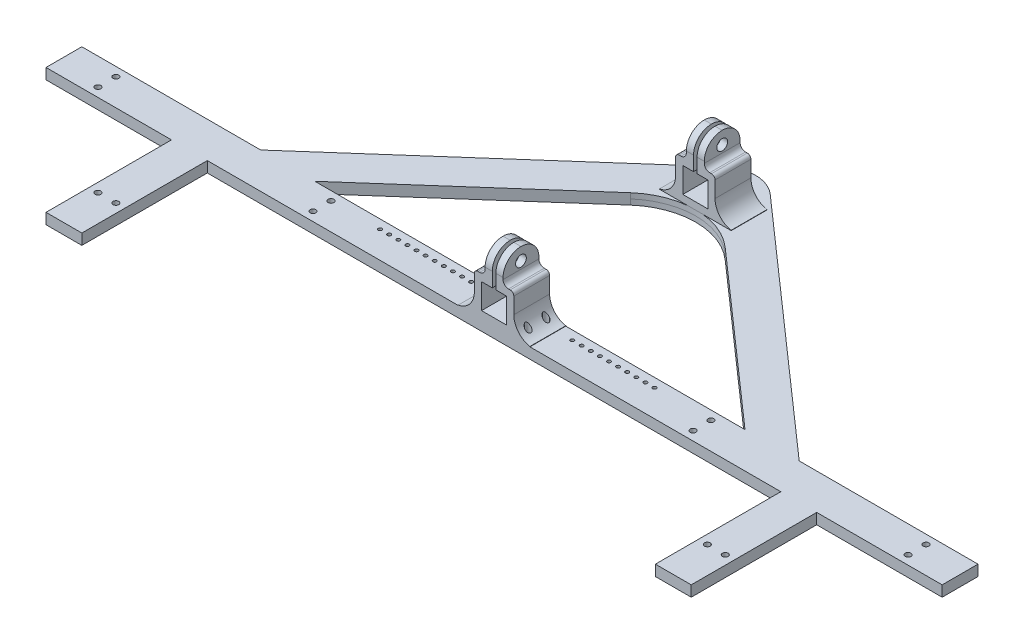
from build123d import *

# Parameters (mm, degrees)
EXTRUDE_1_DEPTH      = 1.5
EXTRUDE_10_DEPTH     = 1.5
FILLET_1_R           = 10
FILLET_2_R           = 20
EXTRUDE_11_DEPTH     = 20
SKETCH_26_W          = 22
SKETCH_26_H          = 10
EXTRUDE_12_DEPTH     = 20
EXTRUDE_13_DEPTH     = 35
EXTRUDE_14_DEPTH     = 35
EXTRUDE_15_DEPTH     = 1.5
FILLET_5_R           = 20
FILLET_6_R           = 10
SKETCH_58_R          = 0.8000000000000042
SKETCH_58_R_2        = 0.8000000000000055
SKETCH_58_R_3        = 0.8000000000000044
SKETCH_58_R_4        = 0.7999999999999963
SKETCH_58_R_5        = 0.8000000000000119
SKETCH_58_R_6        = 0.7999999999999946
SKETCH_58_R_7        = 0.7999999999999954
SKETCH_58_R_8        = 0.7999999999999948
SKETCH_58_R_9        = 0.8000000000000026
CUT_EXTRUDE_52_DEPTH = 145.10569310974057
CUT_EXTRUDE_START    = -66.141850112
CUT_EXTRUDE_53_DEPTH = 66.141850112
FILLET_7_R           = 5
SKETCH_59_R          = 1.5000000000000004
CUT_EXTRUDE_54_DEPTH = 146.77019855456987
SKETCH_60_R          = 1.5000000000000042
CUT_EXTRUDE_55_DEPTH = 146.77019855456987
FILLET_8_R           = 1.5
FILLET_9_R           = 1
CUT_EXTRUDE_56_DEPTH = 144.39264551098404


# Read off the part's stored shape, not the designer's step: 切除-拉伸53
with BuildPart() as part:
    # 草图1 → 凸台-拉伸1 (new body)
    with BuildSketch(Plane(origin=(0, 0, 0), x_dir=(1, 0, 0), z_dir=(0, 1, 0))):
        Polygon((-125, 4.999999999999984), (124.99999999999996, 4.999999999999984), (124.99999999999996, -5.0000000000000115), (-125.00000000000003, -5.0000000000000115), align=None)
    extrude(amount=EXTRUDE_1_DEPTH)



with BuildPart() as body_2:
    # 草图22 → 凸台-拉伸10 (new body)
    with BuildSketch(Plane.XZ):
        Polygon((-3.09e-14, -71.24835955462486), (-3.362e-14, -57.91502622129154), (-60.00000000000021, -4.9999999999999805), (-75.11857892036937, -4.9999999999999805), align=None)
        Polygon((60.00000000000021, -4.9999999999999645), (1.388e-14, -57.91502622129154), (-3.09e-14, -71.24835955462486), (75.1185789203694, -4.999999999999957), align=None)
    extrude(amount=-EXTRUDE_10_DEPTH)

    # 圆角1
    fillet_1_edges = [body_2.edges().sort_by_distance(p)[0] for p in [
        (-8.35e-15, 0.75, -71.24835955462484),
    ]]
    fillet(fillet_1_edges, radius=FILLET_1_R)

    # 圆角2
    fillet_2_edges = [body_2.edges().sort_by_distance(p)[0] for p in [
        (-9.71e-15, 0.75, -57.91502622129154),
    ]]
    fillet(fillet_2_edges, radius=FILLET_2_R)


with BuildPart() as part_1:
    add(part.part)

    add(body_2.part)  # 凸台-拉伸11 merges body 2
    # 草图24 → 凸台-拉伸11 (add)
    with BuildSketch(Plane(origin=(0, 1.5, 0), x_dir=(1, 0, 0), z_dir=(0, 1, 0))):
        Polygon((-10.000000000000004, 4.999999999999999), (9.999999999999996, 4.999999999999999), (9.999999999999996, -5.000000000000001), (-10.000000000000002, -5.000000000000001), align=None)
    extrude(amount=EXTRUDE_11_DEPTH)

    # 草图26 → 凸台-拉伸12 (add)
    with BuildSketch(Plane(origin=(0, 1.5, 0), x_dir=(1, 0, 0), z_dir=(0, 1, 0))):
        with Locations((-1.78e-15, 56.141850111775966)):
            Rectangle(SKETCH_26_W, SKETCH_26_H)
    extrude(amount=EXTRUDE_12_DEPTH)

    # 草图41 → 凸台-拉伸13 (add)
    with BuildSketch(Plane.XY.offset(5.0000000000000115)):
        Polygon((89.99999999999996, 1.4999999999999951), (79.99999999999996, 1.4999999999999951), (79.99999999999996, -4.88e-15), (89.99999999999996, -4.99e-15), (89.99999999999996, 0.7499999999999958), align=None)
    extrude(amount=EXTRUDE_13_DEPTH)

    # 草图42 → 凸台-拉伸14 (add)
    with BuildSketch(Plane.XY.offset(5.0000000000000115)):
        Polygon((-80, 1.4999999999999998), (-90, 1.4999999999999998), (-90, 0.75), (-90, -2.2e-16), (-80, -2.2e-16), align=None)
    extrude(amount=EXTRUDE_14_DEPTH)

    # 草图57 → 凸台-拉伸15 (add)
    with BuildSketch(Plane(origin=(0, 0, 0), x_dir=(-1, 0, 0), z_dir=(0, -1, 0))):
        Polygon((125.00000000000003, -5.0000000000000115), (90, -5.0000000000000115), (90, -40.000000000000014), (80, -40.000000000000014), (80, -5.0000000000000115), (-79.99999999999996, -5.0000000000000115), (-79.99999999999996, -40.000000000000014), (-89.99999999999996, -40.000000000000014), (-89.99999999999994, -5.0000000000000115), (-124.99999999999996, -5.0000000000000115), (-124.99999999999996, 4.999999999999984), (-75.11857892036936, 4.999999999999984), (-6.614378277661482, 65.41502622129155), (-3.024e-14, 71.24835955462483), (6.614378277661415, 65.41502622129157), (75.11857892036936, 4.999999999999984), (125, 4.999999999999984), align=None)
        Polygon((60.00000000000022, 4.999999999999984), (-60.00000000000011, 4.999999999999984), (-2.082e-14, 57.915026221291534), align=None, mode=Mode.SUBTRACT)
    extrude(amount=EXTRUDE_15_DEPTH)

    # 圆角5
    fillet_5_edges = [part_1.edges().sort_by_distance(p)[0] for p in [
        (2.082e-14, -0.75, -57.915026221291534),
    ]]
    fillet(fillet_5_edges, radius=FILLET_5_R)

    # 圆角6
    fillet_6_edges = [part_1.edges().sort_by_distance(p)[0] for p in [
        (3.024e-14, -0.75, -71.24835955462483),
    ]]
    fillet(fillet_6_edges, radius=FILLET_6_R)

    # 草图58 → 切除-拉伸52 (cut, through all)
    with BuildSketch(Plane.XZ.offset(1.5)):
        with Locations(Location((7, 2.499999999999986, 0), (0, 0, 270))):
            Circle(SKETCH_58_R)
        with Locations(Location((6.999999999999998, -2.5000000000000147, 0), (0, 0, 270))):
            Circle(SKETCH_58_R_2)
        with Locations(Location((53, 2.5000000000000027, 0), (0, 0, 270))):
            Circle(SKETCH_58_R_3)
        with Locations(Location((53.000000000000014, -2.5000000000000027, 0), (0, 0, 270))):
            Circle(SKETCH_58_R_4)
        with Locations(Location((112.99999999999994, 2.5000000000000138, 0), (0, 0, 270))):
            Circle(SKETCH_58_R_5)
        with Locations(Location((112.99999999999997, -2.500000000000007, 0), (0, 0, 270))):
            Circle(SKETCH_58_R_6)
        with Locations(Location((-87.5, 28.000000000000014, 0), (0, 0, 270))):
            Circle(SKETCH_58_R_7)
        with Locations(Location((-82.49999999999999, 28.000000000000007, 0), (0, 0, 270))):
            Circle(SKETCH_58_R_8)
        with Locations(Location((-112.99999999999996, -2.5, 0), (0, 0, 270))):
            Circle(SKETCH_58_R_7)
        with Locations(Location((-112.99999999999996, 2.4999999999999987, 0), (0, 0, 270))):
            Circle(SKETCH_58_R_7)
        with Locations(Location((-53, -2.5, 0), (0, 0, 270))):
            Circle(SKETCH_58_R_9)
        with Locations(Location((-53, 2.5, 0), (0, 0, 270))):
            Circle(SKETCH_58_R_9)
        with Locations(Location((82.49999999999999, 28.000000000000036, 0), (0, 0, 270))):
            Circle(SKETCH_58_R_7)
        with Locations(Location((87.5, 28.000000000000036, 0), (0, 0, 270))):
            Circle(SKETCH_58_R_7)
    extrude(amount=-CUT_EXTRUDE_52_DEPTH, mode=Mode.SUBTRACT)

    # 切除-拉伸53 outline → 切除-拉伸53 (cut)
    with BuildSketch(Plane.XY.offset(5.0000000000000115).offset(CUT_EXTRUDE_START)):
        with BuildLine():
            Line((11, 21.5), (-11, 21.5))
            Line((-11, 21.5), (-11, 1.5))
            Line((-11, 1.5), (-10, 1.5))
            Line((-10, 1.5), (-10, 1.591673087))
            ThreePointArc((-10, 1.591673087), (-6.772116369, 3.48218818), (-5.5, 7))
            Line((-5.5, 7), (-5.5, 12.5))
            Line((-5.5, 12.5), (-2.5, 12.5))
            Line((-2.5, 12.5), (-2.5, 19.5))
            Line((-2.5, 19.5), (-0.5, 19.5))
            Line((-0.5, 19.5), (-0.5, 10.5))
            Line((-0.5, 10.5), (-3.5, 10.5))
            Line((-3.5, 10.5), (-3.5, 3.5))
            Line((-3.5, 3.5), (3.5, 3.5))
            Line((3.5, 3.5), (3.5, 10.5))
            Line((3.5, 10.5), (0.5, 10.5))
            Line((0.5, 10.5), (0.5, 19.5))
            Line((0.5, 19.5), (2.5, 19.5))
            Line((2.5, 19.5), (2.5, 12.5))
            Line((2.5, 12.5), (5.5, 12.5))
            Line((5.5, 12.5), (5.5, 7))
            ThreePointArc((5.5, 7), (6.772116369, 3.48218818), (10, 1.591673087))
            Line((10, 1.591673087), (10, 1.5))
            Line((10, 1.5), (11, 1.5))
            Line((11, 1.5), (11, 21.5))
        make_face()
    extrude(amount=CUT_EXTRUDE_53_DEPTH, mode=Mode.SUBTRACT)

    # 圆角7
    fillet_7_edges = [part_1.edges().sort_by_distance(p)[0] for p in [
        (-1.5, 19.5, -51.141850111775966),
        (-1.5, 19.5, -61.141850111999986),
        (1.5, 19.5, -61.141850111999986),
        (1.5, 19.5, -51.141850111775966),
        (-1.5, 19.5, 5.0000000000000115),
        (-1.5, 19.5, -4.999999999999985),
        (1.5, 19.5, -4.999999999999985),
        (1.5, 19.5, 5.0000000000000115),
    ]]
    fillet(fillet_7_edges, radius=FILLET_7_R - 0.0001)  # a hair under: the kernel refuses the full size

    # 草图59 → 切除-拉伸54 (cut, through all)
    with BuildSketch(Plane(origin=(2.5000000000000044, 4.6e-16, 0), x_dir=(0, 0, -1), z_dir=(1, 1.9e-16, 0))):
        with Locations(Location((4.3e-16, 16, 0), (0, 0, 180))):
            Circle(SKETCH_59_R)
    extrude(amount=-CUT_EXTRUDE_54_DEPTH, mode=Mode.SUBTRACT)

    # 草图60 → 切除-拉伸55 (cut, through all)
    with BuildSketch(Plane(origin=(2.5000000000000044, 4.6e-16, 0), x_dir=(0, 0, -1), z_dir=(1, 1.9e-16, 0))):
        with Locations(Location((56.14185011177597, 16, 0), (0, 0, 90))):
            Circle(SKETCH_60_R)
    extrude(amount=-CUT_EXTRUDE_55_DEPTH, mode=Mode.SUBTRACT)

    # 圆角8
    fillet_8_edges = [part_1.edges().sort_by_distance(p)[0] for p in [
        (-2.5, 12.5, 1.421e-14),
        (-2.5, 12.5, -56.141850111887976),
        (2.5, 12.5, 1.421e-14),
        (2.5, 12.5, -56.141850111887976),
    ]]
    fillet(fillet_8_edges, radius=FILLET_8_R)

    # 圆角9
    fillet_9_edges = [part_1.edges().sort_by_distance(p)[0] for p in [
        (5.5, 12.5, 1.421e-14),
        (5.5, 12.5, -56.141850111887976),
        (-5.5, 12.5, 1.421e-14),
        (-5.5, 12.5, -56.141850111887976),
    ]]
    fillet(fillet_9_edges, radius=FILLET_9_R)

    # 草图61 → 切除-拉伸56 (cut, through all)
    with BuildSketch(Plane(origin=(0, 1.5, 0), x_dir=(1, 0, 0), z_dir=(0, 1, 0))):
        with BuildLine():
            ThreePointArc((-38.8, 2.5000000000000075), (-39.3, 3.0000000000000067), (-39.8, 2.5000000000000075))
            Line((-39.8, 2.5000000000000075), (-38.8, 2.5000000000000075))
        make_face()
        with BuildLine():
            Line((-38.8, 2.5000000000000075), (-39.8, 2.5000000000000075))
            ThreePointArc((-39.8, 2.5000000000000075), (-39.3, 2.0000000000000084), (-38.8, 2.5000000000000075))
        make_face()
        with BuildLine():
            ThreePointArc((-36.25999999999999, 2.5000000000000075), (-36.75999999999999, 3.0000000000000067), (-37.25999999999999, 2.5000000000000075))
            Line((-37.25999999999999, 2.5000000000000075), (-36.25999999999999, 2.5000000000000075))
        make_face()
        with BuildLine():
            Line((-36.25999999999999, 2.5000000000000075), (-37.25999999999999, 2.5000000000000075))
            ThreePointArc((-37.25999999999999, 2.5000000000000075), (-36.75999999999999, 2.0000000000000084), (-36.25999999999999, 2.5000000000000075))
        make_face()
        with BuildLine():
            ThreePointArc((-33.71999999999999, 2.5000000000000075), (-34.21999999999999, 3.0000000000000067), (-34.71999999999999, 2.5000000000000075))
            Line((-34.71999999999999, 2.5000000000000075), (-33.71999999999999, 2.5000000000000075))
        make_face()
        with BuildLine():
            Line((-33.71999999999999, 2.5000000000000075), (-34.71999999999999, 2.5000000000000075))
            ThreePointArc((-34.71999999999999, 2.5000000000000075), (-34.21999999999999, 2.0000000000000084), (-33.71999999999999, 2.5000000000000075))
        make_face()
        with BuildLine():
            ThreePointArc((-31.179999999999993, 2.5000000000000075), (-31.679999999999993, 3.0000000000000067), (-32.17999999999999, 2.5000000000000075))
            Line((-32.17999999999999, 2.5000000000000075), (-31.179999999999993, 2.5000000000000075))
        make_face()
        with BuildLine():
            Line((-31.179999999999993, 2.5000000000000075), (-32.17999999999999, 2.5000000000000075))
            ThreePointArc((-32.17999999999999, 2.5000000000000075), (-31.679999999999993, 2.0000000000000084), (-31.179999999999993, 2.5000000000000075))
        make_face()
        with BuildLine():
            ThreePointArc((-28.639999999999993, 2.5000000000000075), (-29.139999999999993, 3.0000000000000067), (-29.639999999999993, 2.5000000000000075))
            Line((-29.639999999999993, 2.5000000000000075), (-28.639999999999993, 2.5000000000000075))
        make_face()
        with BuildLine():
            Line((-28.639999999999993, 2.5000000000000075), (-29.639999999999993, 2.5000000000000075))
            ThreePointArc((-29.639999999999993, 2.5000000000000075), (-29.139999999999993, 2.0000000000000084), (-28.639999999999993, 2.5000000000000075))
        make_face()
        with BuildLine():
            ThreePointArc((-26.09999999999999, 2.5000000000000075), (-26.59999999999999, 3.0000000000000067), (-27.09999999999999, 2.5000000000000075))
            Line((-27.09999999999999, 2.5000000000000075), (-26.09999999999999, 2.5000000000000075))
        make_face()
        with BuildLine():
            Line((-26.09999999999999, 2.5000000000000075), (-27.09999999999999, 2.5000000000000075))
            ThreePointArc((-27.09999999999999, 2.5000000000000075), (-26.59999999999999, 2.0000000000000084), (-26.09999999999999, 2.5000000000000075))
        make_face()
        with BuildLine():
            ThreePointArc((-23.55999999999999, 2.500000000000008), (-24.05999999999999, 3.000000000000007), (-24.55999999999999, 2.500000000000008))
            Line((-24.55999999999999, 2.5000000000000075), (-23.55999999999999, 2.5000000000000075))
        make_face()
        with BuildLine():
            Line((-23.55999999999999, 2.5000000000000075), (-24.55999999999999, 2.5000000000000075))
            ThreePointArc((-24.55999999999999, 2.500000000000008), (-24.05999999999999, 2.000000000000009), (-23.55999999999999, 2.500000000000008))
        make_face()
        with BuildLine():
            ThreePointArc((-21.01999999999999, 2.5000000000000075), (-21.51999999999999, 3.0000000000000067), (-22.01999999999999, 2.5000000000000075))
            Line((-22.01999999999999, 2.5000000000000075), (-21.01999999999999, 2.5000000000000075))
        make_face()
        with BuildLine():
            Line((-21.01999999999999, 2.5000000000000075), (-22.01999999999999, 2.5000000000000075))
            ThreePointArc((-22.01999999999999, 2.5000000000000075), (-21.51999999999999, 2.0000000000000084), (-21.01999999999999, 2.5000000000000075))
        make_face()
        with BuildLine():
            ThreePointArc((-18.47999999999999, 2.5000000000000075), (-18.97999999999999, 3.0000000000000067), (-19.47999999999999, 2.5000000000000075))
            Line((-19.47999999999999, 2.5000000000000075), (-18.47999999999999, 2.5000000000000075))
        make_face()
        with BuildLine():
            Line((-18.47999999999999, 2.5000000000000075), (-19.47999999999999, 2.5000000000000075))
            ThreePointArc((-19.47999999999999, 2.5000000000000075), (-18.97999999999999, 2.0000000000000084), (-18.47999999999999, 2.5000000000000075))
        make_face()
        with BuildLine():
            ThreePointArc((-15.939999999999992, 2.500000000000007), (-16.43999999999999, 3.000000000000006), (-16.93999999999999, 2.500000000000007))
            Line((-16.93999999999999, 2.5000000000000075), (-15.93999999999999, 2.5000000000000075))
        make_face()
        with BuildLine():
            Line((-15.93999999999999, 2.5000000000000075), (-16.93999999999999, 2.5000000000000075))
            ThreePointArc((-16.93999999999999, 2.500000000000007), (-16.43999999999999, 2.000000000000008), (-15.939999999999992, 2.500000000000007))
        make_face()
        with BuildLine():
            ThreePointArc((-13.399999999999988, 2.500000000000008), (-13.899999999999988, 3.000000000000009), (-14.399999999999988, 2.500000000000008))
            Line((-14.399999999999984, 2.5000000000000075), (-13.399999999999984, 2.5000000000000075))
        make_face()
        with BuildLine():
            Line((-13.399999999999984, 2.5000000000000075), (-14.399999999999984, 2.5000000000000075))
            ThreePointArc((-14.399999999999988, 2.500000000000008), (-13.899999999999988, 2.000000000000007), (-13.399999999999988, 2.500000000000008))
        make_face()
        with BuildLine():
            ThreePointArc((-10.859999999999989, 2.5000000000000075), (-11.359999999999989, 3.000000000000008), (-11.859999999999989, 2.5000000000000075))
            Line((-11.859999999999992, 2.5000000000000075), (-10.859999999999992, 2.5000000000000075))
        make_face()
        with BuildLine():
            Line((-10.859999999999992, 2.5000000000000075), (-11.859999999999992, 2.5000000000000075))
            ThreePointArc((-11.859999999999989, 2.5000000000000075), (-11.359999999999989, 2.000000000000007), (-10.859999999999989, 2.5000000000000075))
        make_face()
        with BuildLine():
            ThreePointArc((14.800000000000002, 2.500000000000007), (14.300000000000004, 3.000000000000006), (13.800000000000006, 2.500000000000007))
            Line((13.800000000000006, 2.5000000000000075), (14.800000000000002, 2.5000000000000075))
        make_face()
        with BuildLine():
            Line((14.800000000000002, 2.5000000000000075), (13.800000000000006, 2.5000000000000075))
            ThreePointArc((13.800000000000006, 2.500000000000007), (14.300000000000004, 2.000000000000008), (14.800000000000002, 2.500000000000007))
        make_face()
        with BuildLine():
            ThreePointArc((17.440000000000005, 2.5000000000000075), (16.940000000000005, 3.0000000000000067), (16.440000000000005, 2.5000000000000075))
            Line((16.440000000000005, 2.5000000000000075), (17.440000000000005, 2.5000000000000075))
        make_face()
        with BuildLine():
            Line((17.440000000000005, 2.5000000000000075), (16.440000000000005, 2.5000000000000075))
            ThreePointArc((16.440000000000005, 2.5000000000000075), (16.940000000000005, 2.0000000000000084), (17.440000000000005, 2.5000000000000075))
        make_face()
        with BuildLine():
            ThreePointArc((19.980000000000004, 2.5000000000000075), (19.480000000000004, 3.0000000000000067), (18.980000000000004, 2.5000000000000075))
            Line((18.980000000000004, 2.5000000000000075), (19.980000000000004, 2.5000000000000075))
        make_face()
        with BuildLine():
            Line((19.980000000000004, 2.5000000000000075), (18.980000000000004, 2.5000000000000075))
            ThreePointArc((18.980000000000004, 2.5000000000000075), (19.480000000000004, 2.0000000000000084), (19.980000000000004, 2.5000000000000075))
        make_face()
        with BuildLine():
            ThreePointArc((22.520000000000003, 2.5000000000000075), (22.020000000000003, 3.0000000000000067), (21.520000000000003, 2.5000000000000075))
            Line((21.520000000000003, 2.5000000000000075), (22.520000000000003, 2.5000000000000075))
        make_face()
        with BuildLine():
            Line((22.520000000000003, 2.5000000000000075), (21.520000000000003, 2.5000000000000075))
            ThreePointArc((21.520000000000003, 2.5000000000000075), (22.020000000000003, 2.0000000000000084), (22.520000000000003, 2.5000000000000075))
        make_face()
        with BuildLine():
            ThreePointArc((25.060000000000006, 2.500000000000008), (24.560000000000006, 3.000000000000007), (24.060000000000006, 2.500000000000008))
            Line((24.060000000000006, 2.5000000000000075), (25.060000000000006, 2.5000000000000075))
        make_face()
        with BuildLine():
            Line((25.060000000000006, 2.5000000000000075), (24.060000000000006, 2.5000000000000075))
            ThreePointArc((24.060000000000006, 2.500000000000008), (24.560000000000006, 2.000000000000009), (25.060000000000006, 2.500000000000008))
        make_face()
        with BuildLine():
            ThreePointArc((27.600000000000005, 2.5000000000000075), (27.100000000000005, 3.0000000000000067), (26.600000000000005, 2.5000000000000075))
            Line((26.600000000000005, 2.5000000000000075), (27.600000000000005, 2.5000000000000075))
        make_face()
        with BuildLine():
            Line((27.600000000000005, 2.5000000000000075), (26.600000000000005, 2.5000000000000075))
            ThreePointArc((26.600000000000005, 2.5000000000000075), (27.100000000000005, 2.0000000000000084), (27.600000000000005, 2.5000000000000075))
        make_face()
        with BuildLine():
            ThreePointArc((30.140000000000008, 2.5000000000000075), (29.640000000000008, 3.0000000000000067), (29.140000000000008, 2.5000000000000075))
            Line((29.140000000000008, 2.5000000000000075), (30.140000000000008, 2.5000000000000075))
        make_face()
        with BuildLine():
            Line((30.140000000000008, 2.5000000000000075), (29.140000000000008, 2.5000000000000075))
            ThreePointArc((29.140000000000008, 2.5000000000000075), (29.640000000000008, 2.0000000000000084), (30.140000000000008, 2.5000000000000075))
        make_face()
        with BuildLine():
            ThreePointArc((32.68000000000001, 2.5000000000000075), (32.18000000000001, 3.0000000000000067), (31.680000000000007, 2.5000000000000075))
            Line((31.680000000000007, 2.500000000000007), (32.68000000000001, 2.500000000000007))
        make_face()
        with BuildLine():
            Line((32.68000000000001, 2.500000000000007), (31.680000000000007, 2.500000000000007))
            ThreePointArc((31.680000000000007, 2.5000000000000075), (32.18000000000001, 2.0000000000000084), (32.68000000000001, 2.5000000000000075))
        make_face()
        with BuildLine():
            ThreePointArc((35.220000000000006, 2.5000000000000075), (34.720000000000006, 3.0000000000000067), (34.220000000000006, 2.5000000000000075))
            Line((34.220000000000006, 2.500000000000007), (35.220000000000006, 2.500000000000007))
        make_face()
        with BuildLine():
            Line((35.220000000000006, 2.500000000000007), (34.220000000000006, 2.500000000000007))
            ThreePointArc((34.220000000000006, 2.5000000000000075), (34.720000000000006, 2.0000000000000084), (35.220000000000006, 2.5000000000000075))
        make_face()
        with BuildLine():
            ThreePointArc((37.760000000000005, 2.5000000000000075), (37.260000000000005, 3.0000000000000067), (36.760000000000005, 2.5000000000000075))
            Line((36.760000000000005, 2.500000000000007), (37.760000000000005, 2.500000000000007))
        make_face()
        with BuildLine():
            Line((37.760000000000005, 2.500000000000007), (36.760000000000005, 2.500000000000007))
            ThreePointArc((36.760000000000005, 2.5000000000000075), (37.260000000000005, 2.0000000000000084), (37.760000000000005, 2.5000000000000075))
        make_face()
    extrude(amount=-CUT_EXTRUDE_56_DEPTH, mode=Mode.SUBTRACT)


solid = part_1.part
